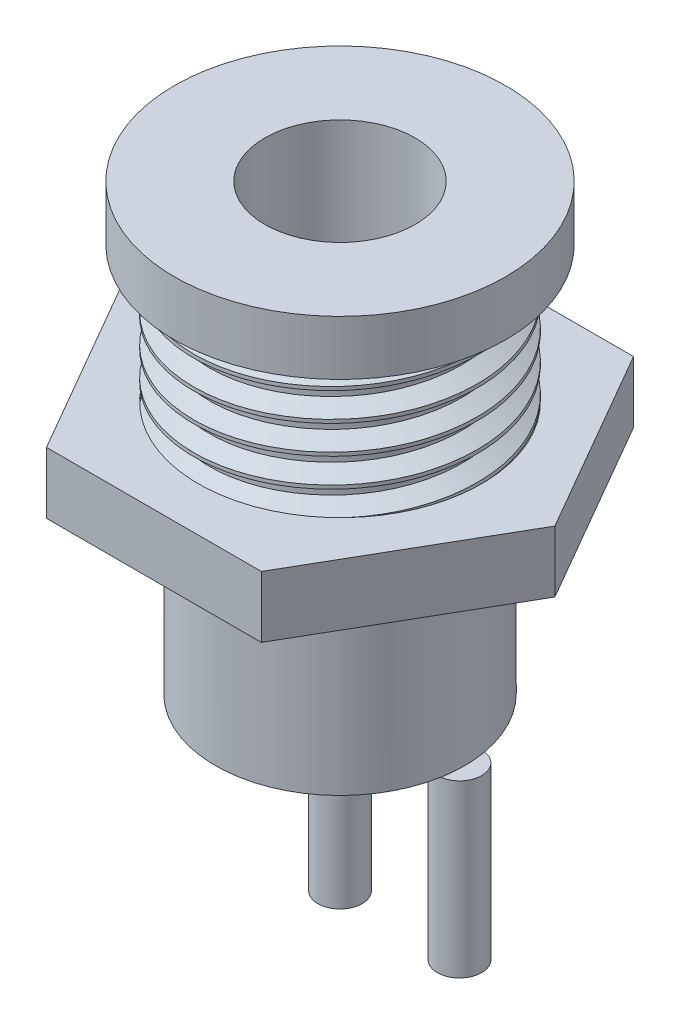
from build123d import *

# Parameters (mm, degrees)
THREAD1_PITCH       = 1.058333333
SKETCH8_R           = 6.1595
SKETCH8_R_2         = 2.794
BOSS_EXTRUDE3_DEPTH = 2.032
SKETCH9_OUTSIDE_W   = 19.12
SKETCH9_OUTSIDE_H   = 19.12
SKETCH9_OUTSIDE_R   = 4.6355
CUT_EXTRUDE1_DEPTH  = 6.35
BOSS_EXTRUDE1_START = 7.366
SKETCH2_R           = 5.2705
BOSS_EXTRUDE1_DEPTH = 2.286
SKETCH3_R           = 0.8255
BOSS_EXTRUDE2_DEPTH = 6.35


with BuildPart() as part:
    # Sketch1 → Revolve1 (revolve)
    with BuildSketch(Plane.XY):
        Polygon((-2.794, 0), (-6.1595, 0), (-6.1595, -2.032), (-5.2705, -2.032), (-5.2705, -16.51), (0, -16.51), (0, -11.938), (-2.794, -11.938), align=None)
    revolve(axis=Axis((0, 0, 0), (0, -1, 0)))

    # Thread1: the profile of Thread Profile1 profile screwed along a right-hand helix of 14 turns, 8 arcs to a turn; built about Z, then put on its axis
    thread1_z = Axis((0, 0, 0), (0, 0, 1))
    thread1_corners = [(5.2708, 0, -0.000173205), (5.2708, 0, 0.926214869), (4.697660282, 0, 0.595312499), (4.697660282, 0, 0.330729165)]
    with BuildLine(mode=Mode.PRIVATE) as thread1_profile:
        Line(thread1_corners[0], thread1_corners[1])
        Line(thread1_corners[1], thread1_corners[2])
        Line(thread1_corners[2], thread1_corners[3])
        Line(thread1_corners[3], thread1_corners[0])
    thread1_cap = Face(thread1_profile.wire())
    thread1_turn_angles = [0, 22.5, 45, 67.5, 90, 112.5, 135, 157.5, 180, 202.5, 225, 247.5, 270, 292.5, 315, 337.5, 360]
    thread1_turn_weights = [1, 0.9238795325112867, 1, 0.9238795325112867, 1, 0.9238795325112867, 1, 0.9238795325112867, 1, 0.9238795325112867, 1, 0.9238795325112867, 1, 0.9238795325112867, 1, 0.9238795325112867, 1]
    thread1_turn_rails = [Edge.make_bspline([Vector(p[0], p[1], 0).rotate(thread1_z, thread1_turn_angles[k]) / thread1_turn_weights[k] + Vector(0, 0, p[2] + THREAD1_PITCH * thread1_turn_angles[k] / 360) for k in range(17)], [0, 0, 0, 1, 1, 2, 2, 3, 3, 4, 4, 5, 5, 6, 6, 7, 7, 8, 8, 8], 2, thread1_turn_weights) for p in thread1_corners]
    thread1_turn_sides = [Face.make_surface_from_curves(thread1_turn_rails[p[0]], thread1_turn_rails[p[1]]) for p in [(0, 1), (1, 2), (2, 3), (3, 0)]]
    thread1 = Plane(origin=(0, -16.51, 0), x_dir=(1, 0, 0), z_dir=(0, 1, 0)) * Solid(Shell([*[p.moved(Location((0, 0, THREAD1_PITCH * i))) for i in range(14) for p in thread1_turn_sides], thread1_cap, thread1_cap.rotate(thread1_z, 5040).moved(Location((0, 0, THREAD1_PITCH * 5040 / 360)))]))
    add(thread1, mode=Mode.SUBTRACT)

    # Sketch8 → Boss-Extrude3 (add)
    with BuildSketch(Plane.XZ.offset(2.032)):
        with Locations(Location((0, 0, 0), (0, 0, 180))):
            Circle(SKETCH8_R)
        with Locations(Location((0, 0, 0), (0, 0, 180))):
            Circle(SKETCH8_R_2, mode=Mode.SUBTRACT)
    extrude(amount=-BOSS_EXTRUDE3_DEPTH)

    # Sketch9 outside → Cut-Extrude1 (cut)
    with BuildSketch(Plane.XZ.offset(16.51)):
        Rectangle(SKETCH9_OUTSIDE_W, SKETCH9_OUTSIDE_H)
        Circle(SKETCH9_OUTSIDE_R, mode=Mode.SUBTRACT)
    extrude(amount=-CUT_EXTRUDE1_DEPTH, mode=Mode.SUBTRACT)

    # Sketch2 → Boss-Extrude1 (add)
    with BuildSketch(Plane.XZ.offset(2.032).offset(BOSS_EXTRUDE1_START)):
        Polygon((7.992259776, 0), (3.996129888, 6.9215), (-3.996129888, 6.9215), (-7.992259776, 0), (-3.996129888, -6.9215), (3.996129888, -6.9215), align=None)
        Circle(SKETCH2_R, mode=Mode.SUBTRACT)
    extrude(amount=-BOSS_EXTRUDE1_DEPTH)

    # Sketch3 → Boss-Extrude2 (add)
    with BuildSketch(Plane.XZ.offset(16.51)):
        Circle(SKETCH3_R)
        with Locations(Location((4.445, 0, 0), (0, 0, 81.786789298))):
            Circle(SKETCH3_R)
    extrude(amount=BOSS_EXTRUDE2_DEPTH)


solid = part.part
